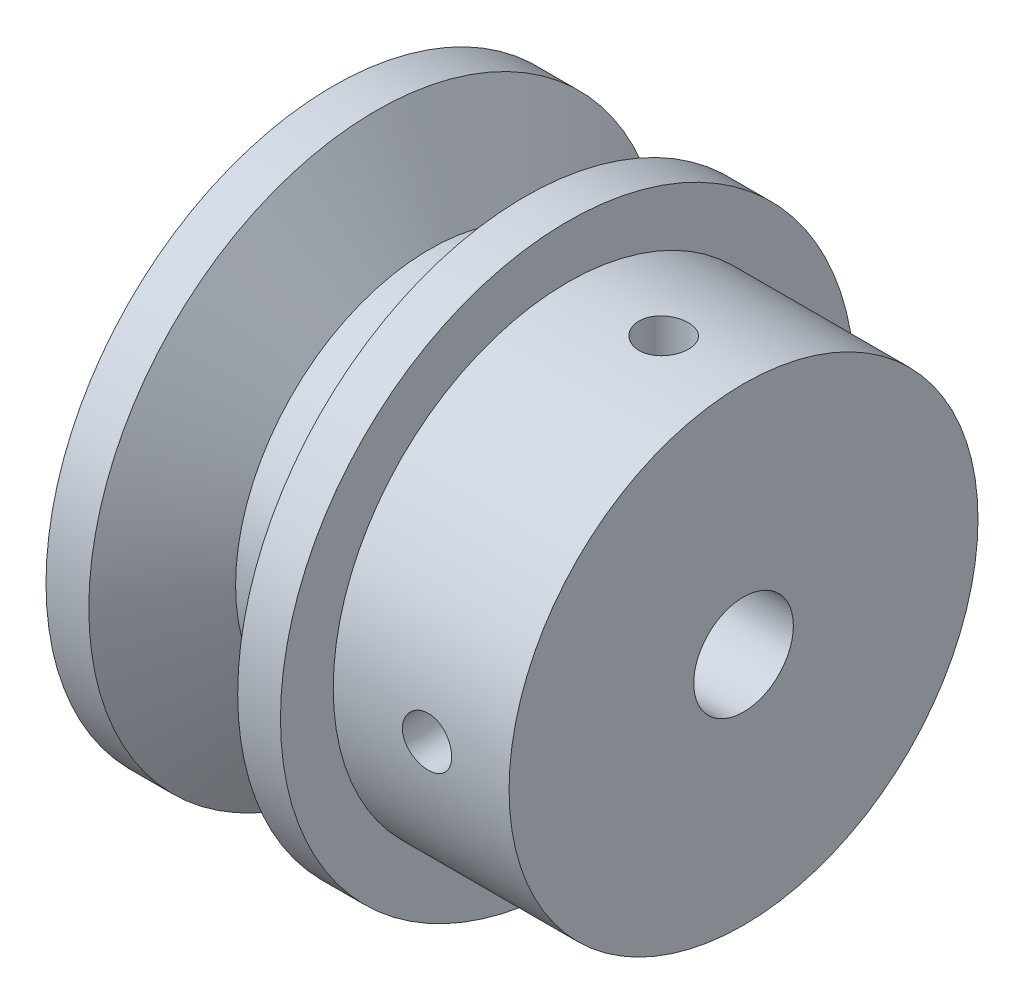
from build123d import *

# Parameters (mm, degrees)
PERFORADOR_PARA_ROSCAR_PARA_MACHO_DE_ROS_D     = 4.2
PERFORADOR_PARA_ROSCAR_PARA_MACHO_DE_ROS_DEPTH = 20
PERFORADOR_PARA_ROSCAR_PARA_MACHO_DE_ROS_TIP   = 1.2618073
PERFORADOR_PARA_ROSCAR_PARA_MACHO_DE_2_D       = 4.2
PERFORADOR_PARA_ROSCAR_PARA_MACHO_DE_2_DEPTH   = 20
PERFORADOR_PARA_ROSCAR_PARA_MACHO_DE_2_TIP     = 1.2618073
PERFORADOR_PARA_ROSCAR_PARA_MACHO_DE_3_D       = 8.5
PERFORADOR_PARA_ROSCAR_PARA_MACHO_DE_3_DEPTH   = 40
PERFORADOR_PARA_ROSCAR_PARA_MACHO_DE_3_TIP     = 2.553657631


with BuildPart() as part:
    # Croquis1 → Revolución1 (revolve)
    with BuildSketch(Plane.XY):
        Polygon((0, 24.5), (0, 0), (35, 0), (35, 20), (20, 20), (20, 24.5), (16.35, 24.5), (11.767282238, 16.5625), (10, 16.5625), (8.232717762, 16.5625), (3.65, 24.5), align=None)
    revolve(axis=Axis((0, 0, 0), (1, 0, 0)))

    # Perforador para roscar para macho de ros
    with Locations(Plane(origin=(28, 0, 20), x_dir=(1, 0, 0), z_dir=(0, 0, 1))):
        with Locations((0, 0)):
            Hole(PERFORADOR_PARA_ROSCAR_PARA_MACHO_DE_ROS_D / 2, depth=PERFORADOR_PARA_ROSCAR_PARA_MACHO_DE_ROS_DEPTH)
            with Locations((0, 0, -(PERFORADOR_PARA_ROSCAR_PARA_MACHO_DE_ROS_DEPTH + PERFORADOR_PARA_ROSCAR_PARA_MACHO_DE_ROS_TIP / 2))):  # 118° drill point
                Cone(0, PERFORADOR_PARA_ROSCAR_PARA_MACHO_DE_ROS_D / 2, PERFORADOR_PARA_ROSCAR_PARA_MACHO_DE_ROS_TIP, mode=Mode.SUBTRACT)

    # Perforador para roscar para macho de 2
    with Locations(Plane(origin=(28, 19.999069745, -0.192897185), x_dir=(0, 0.009645004686, 0.999953485861), z_dir=(0, 0.999953485861, -0.009645004686))):
        with Locations((0, 0)):
            Hole(PERFORADOR_PARA_ROSCAR_PARA_MACHO_DE_2_D / 2, depth=PERFORADOR_PARA_ROSCAR_PARA_MACHO_DE_2_DEPTH)
            with Locations((0, 0, -(PERFORADOR_PARA_ROSCAR_PARA_MACHO_DE_2_DEPTH + PERFORADOR_PARA_ROSCAR_PARA_MACHO_DE_2_TIP / 2))):  # 118° drill point
                Cone(0, PERFORADOR_PARA_ROSCAR_PARA_MACHO_DE_2_D / 2, PERFORADOR_PARA_ROSCAR_PARA_MACHO_DE_2_TIP, mode=Mode.SUBTRACT)

    # Perforador para roscar para macho de 3
    with Locations(Plane(origin=(35, 0, 0), x_dir=(0, 0, -1), z_dir=(1, 0, 0))):
        with Locations((0, 0)):
            Hole(PERFORADOR_PARA_ROSCAR_PARA_MACHO_DE_3_D / 2, depth=PERFORADOR_PARA_ROSCAR_PARA_MACHO_DE_3_DEPTH)
            with Locations((0, 0, -(PERFORADOR_PARA_ROSCAR_PARA_MACHO_DE_3_DEPTH + PERFORADOR_PARA_ROSCAR_PARA_MACHO_DE_3_TIP / 2))):  # 118° drill point
                Cone(0, PERFORADOR_PARA_ROSCAR_PARA_MACHO_DE_3_D / 2, PERFORADOR_PARA_ROSCAR_PARA_MACHO_DE_3_TIP, mode=Mode.SUBTRACT)


solid = part.part
